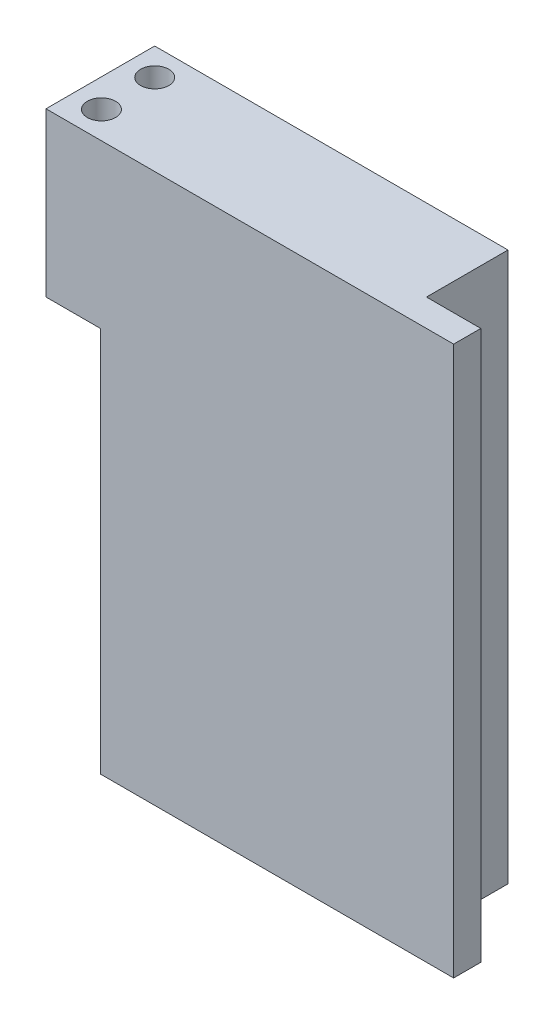
from build123d import *

# Parameters (mm, degrees)
BOSS_EXTRUDE1_DEPTH      = 127
BOSS_EXTRUDE1_DEPTH_BACK = 1.27
SKETCH1_W                = 82.55
SKETCH1_H                = 25.4
SKETCH2_W                = 12.7
SKETCH2_H                = 25.4
BOSS_EXTRUDE2_DEPTH      = 38.1
SKETCH3_R                = 3.302
CUT_EXTRUDE1_DEPTH       = 53.34
SKETCH4_R                = 3.302
CUT_EXTRUDE2_DEPTH       = 72.898
SKETCH7_W                = 12.7
SKETCH7_H                = 19.05
CUT_EXTRUDE5_DEPTH       = 155.637820083


with BuildPart() as part:
    # Sketch1 → Boss-Extrude1 (new, two sides: drawn at the far end of the back side and taken through both)
    with BuildSketch(Plane(origin=(0, 0, 0), x_dir=(1, 0, 0), z_dir=(0, 1, 0)).offset(-BOSS_EXTRUDE1_DEPTH_BACK)):
        with Locations((41.275, -12.7)):
            Rectangle(SKETCH1_W, SKETCH1_H)
    extrude(amount=BOSS_EXTRUDE1_DEPTH + BOSS_EXTRUDE1_DEPTH_BACK)

    # Sketch2 → Boss-Extrude2 (add)
    with BuildSketch(Plane(origin=(0, 127, 0), x_dir=(1, 0, 0), z_dir=(0, 1, 0))):
        with Locations((-6.35, -12.7)):
            Rectangle(SKETCH2_W, SKETCH2_H)
    extrude(amount=-BOSS_EXTRUDE2_DEPTH)

    # Sketch3 → Cut-Extrude1 (cut)
    with BuildSketch(Plane(origin=(0, 127, 0), x_dir=(1, 0, 0), z_dir=(0, 1, 0))):
        with Locations((-6.096, -19.05)):
            Circle(SKETCH3_R)
    extrude(amount=-CUT_EXTRUDE1_DEPTH, mode=Mode.SUBTRACT)

    # Sketch4 → Cut-Extrude2 (cut)
    with BuildSketch(Plane(origin=(0, 127, 0), x_dir=(1, 0, 0), z_dir=(0, 1, 0))):
        with Locations((-6.35, -6.35)):
            Circle(SKETCH4_R)
    extrude(amount=-CUT_EXTRUDE2_DEPTH, mode=Mode.SUBTRACT)

    # Sketch7 → Cut-Extrude5 (cut, through all)
    with BuildSketch(Plane(origin=(0, 127, 0), x_dir=(1, 0, 0), z_dir=(0, 1, 0))):
        with Locations((76.2, -9.525)):
            Rectangle(SKETCH7_W, SKETCH7_H)
    extrude(amount=-CUT_EXTRUDE5_DEPTH, mode=Mode.SUBTRACT)


solid = part.part
